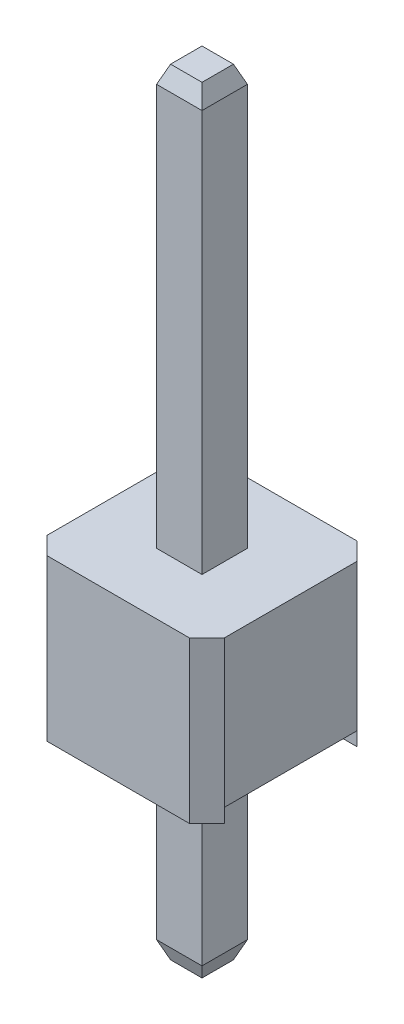
from build123d import *
from OCP.BRepFilletAPI import BRepFilletAPI_MakeChamfer

# Parameters (mm, degrees)
SKETCH1_W           = 0.65
SKETCH1_H           = 0.65
BOSS_EXTRUDE1_DEPTH = 11.3
CHAMFER1_SIZE       = 0.25
CHAMFER1_SIZE2      = 0.1
CHAMFER2_SIZE       = 0.1
CHAMFER2_SIZE2      = 0.25
SKETCH2_W           = 2.54
SKETCH2_H           = 2.4
BOSS_EXTRUDE2_DEPTH = 2.3
CHAMFER3_SIZE       = 0.25
SKETCH6_W           = 1.9
SKETCH6_H           = 0.2
CUT_EXTRUDE5_DEPTH  = 6
SKETCH7_W           = 0.65
SKETCH7_H           = 0.65
BOSS_EXTRUDE4_DEPTH = 3
CHAMFER5_SIZE       = 0.25
CHAMFER5_SIZE2      = 0.1


with BuildPart() as part:
    # Sketch1 → Boss-Extrude1 (new body)
    with BuildSketch(Plane(origin=(0, 0, 0), x_dir=(1, 0, 0), z_dir=(0, 1, 0))):
        with Locations((0.325, -0.325)):
            Rectangle(SKETCH1_W, SKETCH1_H)
    extrude(amount=BOSS_EXTRUDE1_DEPTH)

    # Chamfer1: one chamfer whose edges measure the first distance from different faces: ONE call of the kernel's chamfer builder (chamfer() names one face for all edges)
    chamfer1_edges_1 = [part.edges().sort_by_distance(p)[0] for p in [
        (0.325, 11.3, 0),
    ]]
    chamfer1_side_1 = [part.faces().sort_by_distance(p)[0] for p in [
        (0.325, 5.65, 0),
    ]]
    chamfer1_edges_2 = [part.edges().sort_by_distance(p)[0] for p in [
        (0.65, 11.3, 0.325),
    ]]
    chamfer1_side_2 = [part.faces().sort_by_distance(p)[0] for p in [
        (0.65, 5.65, 0.325),
    ]]
    chamfer1_edges_3 = [part.edges().sort_by_distance(p)[0] for p in [
        (0.325, 11.3, 0.65),
    ]]
    chamfer1_side_3 = [part.faces().sort_by_distance(p)[0] for p in [
        (0.325, 5.65, 0.65),
    ]]
    chamfer1_edges_4 = [part.edges().sort_by_distance(p)[0] for p in [
        (0, 11.3, 0.325),
    ]]
    chamfer1_side_4 = [part.faces().sort_by_distance(p)[0] for p in [
        (0, 5.65, 0.325),
    ]]
    chamfer1 = BRepFilletAPI_MakeChamfer(part.part.solid().wrapped)
    for e in chamfer1_edges_1:
        chamfer1.Add(CHAMFER1_SIZE, CHAMFER1_SIZE2, e.wrapped, chamfer1_side_1[0].wrapped)  # the first distance lies on this face
    for e in chamfer1_edges_2:
        chamfer1.Add(CHAMFER1_SIZE, CHAMFER1_SIZE2, e.wrapped, chamfer1_side_2[0].wrapped)  # the first distance lies on this face
    for e in chamfer1_edges_3:
        chamfer1.Add(CHAMFER1_SIZE, CHAMFER1_SIZE2, e.wrapped, chamfer1_side_3[0].wrapped)  # the first distance lies on this face
    for e in chamfer1_edges_4:
        chamfer1.Add(CHAMFER1_SIZE, CHAMFER1_SIZE2, e.wrapped, chamfer1_side_4[0].wrapped)  # the first distance lies on this face
    add(Compound.cast(chamfer1.Shape()), mode=Mode.REPLACE)

    # Chamfer2
    chamfer2_edges = [part.edges().sort_by_distance(p)[0] for p in [
        (0.325, 0, 0.65),
        (0.65, 0, 0.325),
        (0.325, 0, 0),
        (0, 0, 0.325),
    ]]
    chamfer2_side = [part.faces().sort_by_distance(p)[0] for p in [
        (0.325, 0, 0.325),
    ]]
    chamfer(chamfer2_edges, length=CHAMFER2_SIZE, length2=CHAMFER2_SIZE2, reference=chamfer2_side[0])

    # Sketch2 → Boss-Extrude2 (add)
    with BuildSketch(Plane(origin=(0, 3, 0), x_dir=(-1, 0, 0), z_dir=(0, -1, 0))):
        with Locations((-0.325, -0.325)):
            Rectangle(SKETCH2_W, SKETCH2_H)
    extrude(amount=-BOSS_EXTRUDE2_DEPTH)

    # Chamfer3
    chamfer3_edges = [part.edges().sort_by_distance(p)[0] for p in [
        (-0.945, 4.15, -0.875),
        (-0.945, 4.15, 1.525),
        (1.595, 4.15, 1.525),
        (1.595, 4.15, -0.875),
    ]]
    chamfer(chamfer3_edges, length=CHAMFER3_SIZE)

    # Sketch6 → Cut-Extrude5 (cut)
    with BuildSketch(Plane(origin=(1.595, 0, 0), x_dir=(0, 0, -1), z_dir=(1, 0, 0))):
        with Locations((-0.325, 3.1)):
            Rectangle(SKETCH6_W, SKETCH6_H)
    extrude(amount=-CUT_EXTRUDE5_DEPTH, mode=Mode.SUBTRACT)


with BuildPart() as body_2:
    # of the pieces the cut leaves, the one that is kept (cut_extrude5_keep)
    add(part.part.solids().sort_by_distance((1.345, 3, -0.875))[0])

    # Sketch7 → Boss-Extrude4 (add)
    with BuildSketch(Plane.XZ.offset(-3.2)):
        with Locations((0.325, 0.325)):
            Rectangle(SKETCH7_W, SKETCH7_H)
    extrude(amount=BOSS_EXTRUDE4_DEPTH)

    # Chamfer5: one chamfer whose edges measure the first distance from different faces: ONE call of the kernel's chamfer builder (chamfer() names one face for all edges)
    chamfer5_edges_1 = [body_2.edges().sort_by_distance(p)[0] for p in [
        (0.325, 0.2, 0.65),
    ]]
    chamfer5_side_1 = [body_2.faces().sort_by_distance(p)[0] for p in [
        (0.325, 1.7, 0.65),
    ]]
    chamfer5_edges_2 = [body_2.edges().sort_by_distance(p)[0] for p in [
        (0.65, 0.2, 0.325),
    ]]
    chamfer5_side_2 = [body_2.faces().sort_by_distance(p)[0] for p in [
        (0.65, 1.7, 0.325),
    ]]
    chamfer5_edges_3 = [body_2.edges().sort_by_distance(p)[0] for p in [
        (0.325, 0.2, 0),
    ]]
    chamfer5_side_3 = [body_2.faces().sort_by_distance(p)[0] for p in [
        (0.325, 1.7, 0),
    ]]
    chamfer5_edges_4 = [body_2.edges().sort_by_distance(p)[0] for p in [
        (0, 0.2, 0.325),
    ]]
    chamfer5_side_4 = [body_2.faces().sort_by_distance(p)[0] for p in [
        (0, 1.7, 0.325),
    ]]
    chamfer5 = BRepFilletAPI_MakeChamfer(body_2.part.solid().wrapped)
    for e in chamfer5_edges_1:
        chamfer5.Add(CHAMFER5_SIZE, CHAMFER5_SIZE2, e.wrapped, chamfer5_side_1[0].wrapped)  # the first distance lies on this face
    for e in chamfer5_edges_2:
        chamfer5.Add(CHAMFER5_SIZE, CHAMFER5_SIZE2, e.wrapped, chamfer5_side_2[0].wrapped)  # the first distance lies on this face
    for e in chamfer5_edges_3:
        chamfer5.Add(CHAMFER5_SIZE, CHAMFER5_SIZE2, e.wrapped, chamfer5_side_3[0].wrapped)  # the first distance lies on this face
    for e in chamfer5_edges_4:
        chamfer5.Add(CHAMFER5_SIZE, CHAMFER5_SIZE2, e.wrapped, chamfer5_side_4[0].wrapped)  # the first distance lies on this face
    add(Compound.cast(chamfer5.Shape()), mode=Mode.REPLACE)


solid = body_2.part
